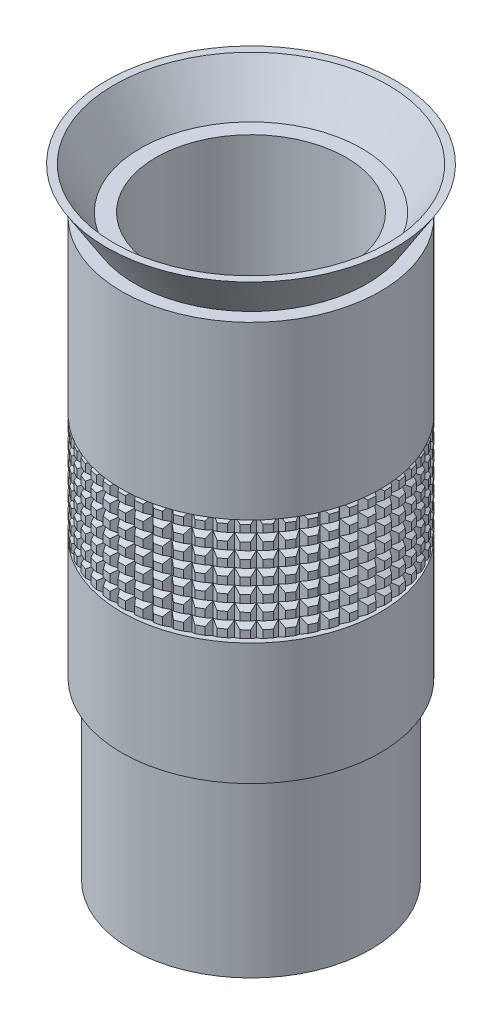
from build123d import *

# Parameters (mm, degrees)
ENL_V_START                  = 14
ENL_V_MAT_EXTRU_1_DEPTH      = 14
R_P_TITION_CIRCULAIRE1_COUNT = 50


with BuildPart() as part:
    # Esquisse1 → Révolution1 (revolve)
    with BuildSketch(Plane.XY):
        Polygon((13.75, 0), (13.75, 20), (12.5, 20), (12.5, 76), (14.5625, 76), (18, 81.5), (19, 81.5), (15.25, 75.5), (17, 75.5), (17, 53), (16.2, 53), (17, 52.5), (17, 51.5), (16.2, 51), (17, 50.5), (17, 49.5), (16.2, 49), (17, 48.5), (17, 47.5), (16.2, 47), (17, 46.5), (17, 45.5), (16.2, 45), (17, 44.5), (17, 43.5), (16.2, 43), (17, 42.5), (17, 41.5), (16.2, 41), (17, 40.5), (17, 39.5), (16.2, 39), (17, 39), (17, 23), (15.75, 23), (15.75, 0), align=None)
    revolve(axis=Axis((0, 0, 0), (0, 1, 0)))

    # Esquisse2 → Enlèv. mat.-Extru.1 (cut)
    with BuildSketch(Plane.XZ.offset(-53).offset(ENL_V_START)):
        with BuildLine():
            Line((-0.5, 16.992645468), (-1.017206416, 16.168033001))
            Line((-1.017206416, 16.168033001), (-1.839298102, 21.961954799))
            ThreePointArc((-1.839298102, 21.961954799), (0.15400752, 22.038302062), (2.146051462, 21.934104477))
            Line((2.146051462, 21.934104477), (1.017206416, 16.168033001))
            Line((1.017206416, 16.168033001), (0.5, 16.992645468))
            ThreePointArc((0.5, 16.992645468), (0, 17), (-0.5, 16.992645468))
        make_face()
    enl_v_mat_extru_1 = extrude(amount=-ENL_V_MAT_EXTRU_1_DEPTH, mode=Mode.SUBTRACT)

    # Répétition circulaire1: Enlèv. mat.-Extru.1 ×50 about axis
    r_p_tition_circulaire1_axis = Axis((0, 0, 0), (0, -1, 0))
    for i in range(1, R_P_TITION_CIRCULAIRE1_COUNT):
        add(enl_v_mat_extru_1.rotate(r_p_tition_circulaire1_axis, i * 360 / R_P_TITION_CIRCULAIRE1_COUNT), mode=Mode.SUBTRACT)


solid = part.part
